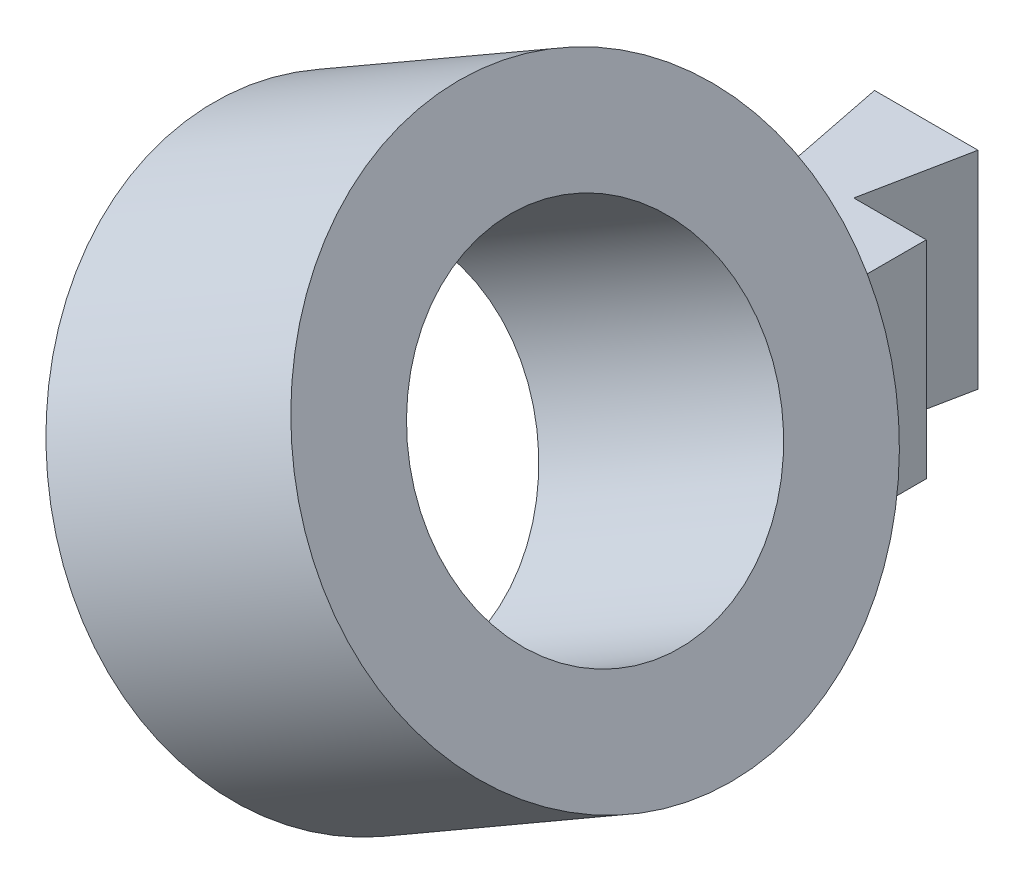
from build123d import *
from build123d.topology import SkipClean

# Parameters (mm, degrees)
BOSS_EXTRUDE1_DEPTH     = 10
SKETCH2_R               = 13.15
SKETCH2_R_2             = 8.15
BOSS_EXTRUDE2_DEPTH     = 13.660254
BOSS_EXTRUDE4_OUTLINE_W = 10
BOSS_EXTRUDE4_OUTLINE_H = 10
BOSS_EXTRUDE4_DEPTH     = 3.254420179


# Read off the part's stored shape, not the designer's step: Boss-Extrude4
with BuildPart() as part:
    # Sketch1 → Boss-Extrude1 (new body)
    with BuildSketch(Plane(origin=(0, 0, 0), x_dir=(1, 0, 0), z_dir=(0, 1, 0))):
        Polygon((-5, -2.85), (-5, 5), (-7.5, 5), (-6.5, 0), (-10, 0), (-10, -2.85), align=None)
        Polygon((0, 0), (-3.5, 0), (-2.5, 5), (-5, 5), (-5, -2.85), (0, -2.85), align=None)
    extrude(amount=BOSS_EXTRUDE1_DEPTH)



with BuildPart() as body_2:
    # Sketch2 → Boss-Extrude2 (new body)
    with BuildSketch(Plane(origin=(4.330127019, 2.5, 0), x_dir=(0, 0, -1), z_dir=(-0.8660254037844362, -0.5000000000000041, 0))):
        with Locations(Location((-16, -8.660254038, 0), (0, 0, 270))):
            Circle(SKETCH2_R)
        with Locations(Location((-16, -8.660254038, 0), (0, 0, 270))):
            Circle(SKETCH2_R_2, mode=Mode.SUBTRACT)
    extrude(amount=BOSS_EXTRUDE2_DEPTH)


with BuildPart() as part_1:
    with SkipClean():  # the faces are left unmerged after this step: merging them gives an invalid solid
        add(part.part)

        add(body_2.part)  # Boss-Extrude4 merges body 2
        # Boss-Extrude4 outline → Boss-Extrude4 (add)
        with BuildSketch(Plane.XY.offset(2.85)):
            with Locations((-5, 5)):
                Rectangle(BOSS_EXTRUDE4_OUTLINE_W, BOSS_EXTRUDE4_OUTLINE_H)
        extrude(amount=BOSS_EXTRUDE4_DEPTH)


solid = part_1.part
